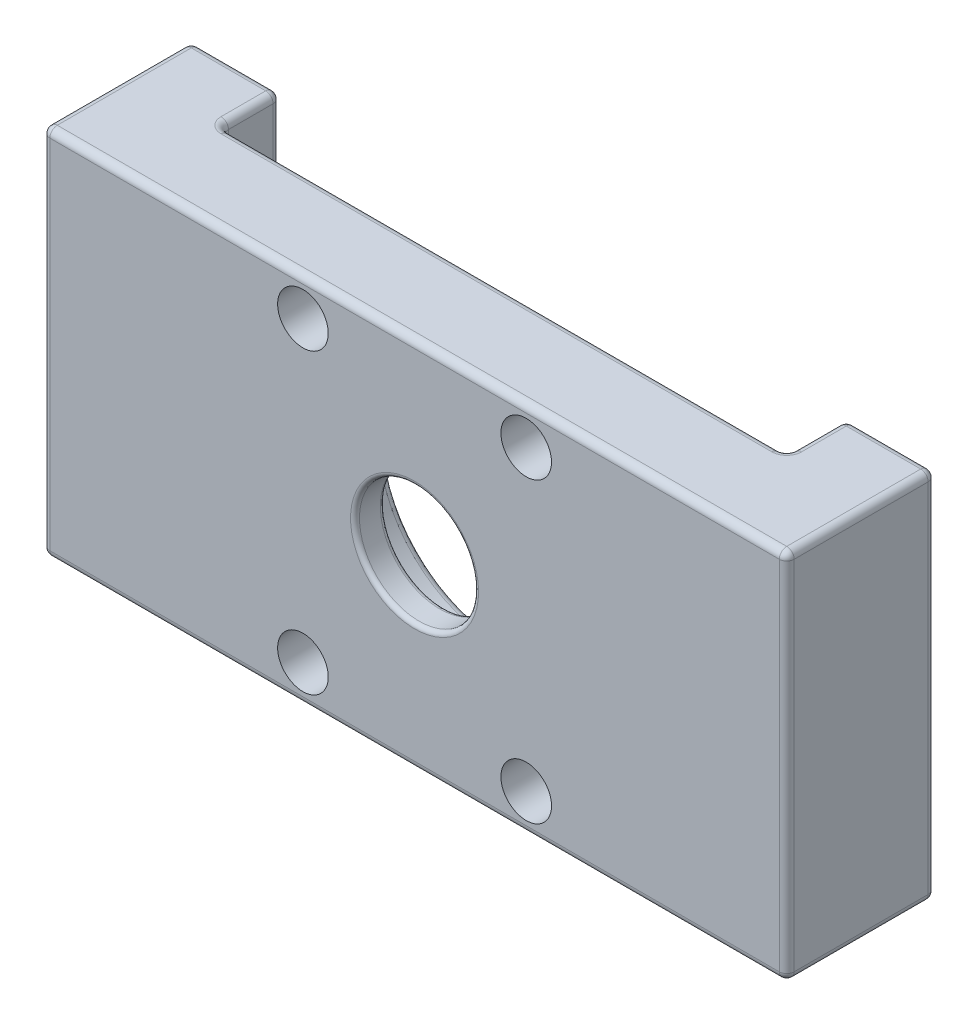
from build123d import *

# Parameters (mm, degrees)
SKETCH1_W               = 50
SKETCH1_H               = 25
SKETCH1_R               = 1.7
BOSS_EXTRUDE1_DEPTH     = 6
SKETCH2_R               = 4
CUT_EXTRUDE1_DEPTH      = 4
CUT_EXTRUDE2_DEPTH      = 2
CUT_EXTRUDE2_DEPTH_BACK = 45.337033054
SKETCH3_R               = 7.9
SKETCH5_W               = 6
SKETCH5_H               = 25
BOSS_EXTRUDE3_DEPTH     = 4
FILLET1_R               = 0.5
FILLET2_R               = 0.5
FILLET3_R               = 0.3


with BuildPart() as part:
    # Sketch1 → Boss-Extrude1 (new body)
    with BuildSketch(Plane.XY):
        with Locations((17.35, 0)):
            Rectangle(SKETCH1_W, SKETCH1_H)
        with Locations((9.85, 10)):
            Circle(SKETCH1_R, mode=Mode.SUBTRACT)
        with Locations(Location((24.85, 10, 0), (0, 0, 180))):
            Circle(SKETCH1_R, mode=Mode.SUBTRACT)
        with Locations((24.85, -10)):
            Circle(SKETCH1_R, mode=Mode.SUBTRACT)
        with Locations(Location((9.85, -10, 0), (0, 0, 180))):
            Circle(SKETCH1_R, mode=Mode.SUBTRACT)
    extrude(amount=BOSS_EXTRUDE1_DEPTH)

    # Sketch2 → Cut-Extrude1 (cut)
    with BuildSketch(Plane.XY.offset(6)):
        with Locations((17.35, 0)):
            Circle(SKETCH2_R)
    extrude(amount=-CUT_EXTRUDE1_DEPTH, mode=Mode.SUBTRACT)

    # Sketch3 → Cut-Extrude2 (cut, two sides: drawn at the far end of the back side and taken through both)
    with BuildSketch(Plane.XY.offset(2).offset(-CUT_EXTRUDE2_DEPTH_BACK)):
        with Locations((17.35, 0)):
            Circle(SKETCH3_R)
    extrude(amount=CUT_EXTRUDE2_DEPTH + CUT_EXTRUDE2_DEPTH_BACK, mode=Mode.SUBTRACT)

    # Sketch5 → Boss-Extrude3 (add)
    with BuildSketch(Plane(origin=(0, 0, 0), x_dir=(-1, 0, 0), z_dir=(0, 0, -1))):
        with Locations((4.65, 0)):
            Rectangle(SKETCH5_W, SKETCH5_H)
        with Locations((-39.35, 0)):
            Rectangle(SKETCH5_W, SKETCH5_H)
    extrude(amount=BOSS_EXTRUDE3_DEPTH)

    # Fillet1
    # the kernel refuses this fillet: 0.5 mm, written as the material it adds along each edge
    with BuildSketch(Plane(origin=(-1.65, 12.5, 0), x_dir=(0, 0, -1), z_dir=(0, -1, 0)), Plane(origin=(36.35, 12.5, 0), x_dir=(-1, 0, 0), z_dir=(0, -1, 0))) as fillet1_piece_1:
        with BuildLine():
            CenterArc((FILLET1_R, FILLET1_R), FILLET1_R, 180, 90)
            Line((0, FILLET1_R), (0, 0))
            Line((0, 0), (FILLET1_R, 0))
        make_face()
    extrude(amount=25)
    # the kernel refuses this fillet: 0.5 mm, written as the material it takes off along each edge
    with BuildSketch(Plane(origin=(-7.15, -12, 5.5), x_dir=(0, 0, 1), z_dir=(-1, 0, 0))) as fillet1_2_piece_1_section:
        Polygon((0, 0), (FILLET1_R, 0), (FILLET1_R, -FILLET1_R), (0, -FILLET1_R), align=None)
    fillet1_2_piece_1 = extrude(amount=FILLET1_R, mode=Mode.PRIVATE)
    fillet1_2_piece_1 = fillet1_2_piece_1 - Plane(origin=(-7.15, -12, 5.5), x_dir=(0, 0.7071067811865475, -0.7071067811865475), z_dir=(-1, 0, 0)) * Sphere(FILLET1_R, mode=Mode.PRIVATE)
    add(fillet1_2_piece_1, mode=Mode.SUBTRACT)
    with BuildSketch(Plane(origin=(41.85, -12, 5.5), x_dir=(0, -1, 0), z_dir=(0, 0, 1))) as fillet1_2_piece_2_section:
        Polygon((0, 0), (FILLET1_R, 0), (FILLET1_R, FILLET1_R), (0, FILLET1_R), align=None)
    fillet1_2_piece_2 = extrude(amount=FILLET1_R, mode=Mode.PRIVATE)
    fillet1_2_piece_2 = fillet1_2_piece_2 - Plane(origin=(41.85, -12, 5.5), x_dir=(-0.7071067811865475, 0.7071067811865475, 0), z_dir=(0, 0, 1)) * Sphere(FILLET1_R, mode=Mode.PRIVATE)
    add(fillet1_2_piece_2, mode=Mode.SUBTRACT)
    with BuildSketch(Plane(origin=(41.85, 12, 5.5), x_dir=(0, 0, 1), z_dir=(0, 1, 0))) as fillet1_2_piece_3_section:
        Polygon((0, 0), (FILLET1_R, 0), (FILLET1_R, FILLET1_R), (0, FILLET1_R), align=None)
    fillet1_2_piece_3 = extrude(amount=FILLET1_R, mode=Mode.PRIVATE)
    fillet1_2_piece_3 = fillet1_2_piece_3 - Plane(origin=(41.85, 12, 5.5), x_dir=(-0.7071067811865475, 0, -0.7071067811865475), z_dir=(0, 1, 0)) * Sphere(FILLET1_R, mode=Mode.PRIVATE)
    add(fillet1_2_piece_3, mode=Mode.SUBTRACT)
    with BuildSketch(Plane(origin=(-7.15, -12, -3.5), x_dir=(0, -1, 0), z_dir=(-1, 0, 0))) as fillet1_2_piece_4_section:
        Polygon((0, 0), (FILLET1_R, 0), (FILLET1_R, -FILLET1_R), (0, -FILLET1_R), align=None)
    fillet1_2_piece_4 = extrude(amount=FILLET1_R, mode=Mode.PRIVATE)
    fillet1_2_piece_4 = fillet1_2_piece_4 - Plane(origin=(-7.15, -12, -3.5), x_dir=(0, 0.7071067811865475, 0.7071067811865475), z_dir=(-1, 0, 0)) * Sphere(FILLET1_R, mode=Mode.PRIVATE)
    add(fillet1_2_piece_4, mode=Mode.SUBTRACT)
    with BuildSketch(Plane(origin=(-7.15, 12, -3.5), x_dir=(0, 1, 0), z_dir=(-1, 0, 0))) as fillet1_2_piece_5_section:
        Polygon((0, 0), (FILLET1_R, 0), (FILLET1_R, FILLET1_R), (0, FILLET1_R), align=None)
    fillet1_2_piece_5 = extrude(amount=FILLET1_R, mode=Mode.PRIVATE)
    fillet1_2_piece_5 = fillet1_2_piece_5 - Plane(origin=(-7.15, 12, -3.5), x_dir=(0, -0.7071067811865475, 0.7071067811865475), z_dir=(-1, 0, 0)) * Sphere(FILLET1_R, mode=Mode.PRIVATE)
    add(fillet1_2_piece_5, mode=Mode.SUBTRACT)
    with BuildSketch(Plane(origin=(-7.15, 12, 5.5), x_dir=(0, 1, 0), z_dir=(-1, 0, 0))) as fillet1_2_piece_6_section:
        Polygon((0, 0), (FILLET1_R, 0), (FILLET1_R, -FILLET1_R), (0, -FILLET1_R), align=None)
    fillet1_2_piece_6 = extrude(amount=FILLET1_R, mode=Mode.PRIVATE)
    fillet1_2_piece_6 = fillet1_2_piece_6 - Plane(origin=(-7.15, 12, 5.5), x_dir=(0, -0.7071067811865475, -0.7071067811865475), z_dir=(-1, 0, 0)) * Sphere(FILLET1_R, mode=Mode.PRIVATE)
    add(fillet1_2_piece_6, mode=Mode.SUBTRACT)
    with BuildSketch(Plane(origin=(41.85, 12, -3.5), x_dir=(1, 0, 0), z_dir=(0, 1, 0))) as fillet1_2_piece_7_section:
        Polygon((0, 0), (FILLET1_R, 0), (FILLET1_R, FILLET1_R), (0, FILLET1_R), align=None)
    fillet1_2_piece_7 = extrude(amount=FILLET1_R, mode=Mode.PRIVATE)
    fillet1_2_piece_7 = fillet1_2_piece_7 - Plane(origin=(41.85, 12, -3.5), x_dir=(-0.7071067811865475, 0, 0.7071067811865475), z_dir=(0, 1, 0)) * Sphere(FILLET1_R, mode=Mode.PRIVATE)
    add(fillet1_2_piece_7, mode=Mode.SUBTRACT)
    with BuildSketch(Plane(origin=(41.85, -12, -3.5), x_dir=(0, -1, 0), z_dir=(0, 0, -1))) as fillet1_2_piece_8_section:
        Polygon((0, 0), (FILLET1_R, 0), (FILLET1_R, -FILLET1_R), (0, -FILLET1_R), align=None)
    fillet1_2_piece_8 = extrude(amount=FILLET1_R, mode=Mode.PRIVATE)
    fillet1_2_piece_8 = fillet1_2_piece_8 - Plane(origin=(41.85, -12, -3.5), x_dir=(-0.7071067811865475, 0.7071067811865475, 0), z_dir=(0, 0, -1)) * Sphere(FILLET1_R, mode=Mode.PRIVATE)
    add(fillet1_2_piece_8, mode=Mode.SUBTRACT)
    with BuildSketch(Plane(origin=(9.85, 10, 0), x_dir=(1, 0, 0), z_dir=(0, -1, 0))) as fillet1_2_piece_9:
        with BuildLine():
            CenterArc((1.7 + FILLET1_R, FILLET1_R), FILLET1_R, 180, 90)
            Line((1.7, FILLET1_R), (1.7, 0))
            Line((1.7, 0), (1.7 + FILLET1_R, 0))
        make_face()
    revolve(axis=Axis((9.85, 10, 0), (0, 0, 1)), mode=Mode.SUBTRACT)
    with BuildSketch(Plane(origin=(-7.15, -12.5, 6), x_dir=(0, 1, 0), z_dir=(1, 0, 0))) as fillet1_2_piece_10:
        with BuildLine():
            CenterArc((FILLET1_R, -FILLET1_R), FILLET1_R, 90, 90)
            Line((0, -FILLET1_R), (0, 0))
            Line((0, 0), (FILLET1_R, 0))
        make_face()
    extrude(amount=49, mode=Mode.SUBTRACT)
    with BuildSketch(Plane(origin=(24.85, 10, 0), x_dir=(-1, 0, 0), z_dir=(0, 1, 0))) as fillet1_2_piece_11:
        with BuildLine():
            CenterArc((1.7 + FILLET1_R, FILLET1_R), FILLET1_R, 180, 90)
            Line((1.7, FILLET1_R), (1.7, 0))
            Line((1.7, 0), (1.7 + FILLET1_R, 0))
        make_face()
    revolve(axis=Axis((24.85, 10, 0), (0, 0, 1)), mode=Mode.SUBTRACT)
    with BuildSketch(Plane(origin=(42.35, -12, 6), x_dir=(-1, 0, 0), z_dir=(0, 1, 0)), Plane(origin=(42.35, -12, -4), x_dir=(0, 0, 1), z_dir=(0, 1, 0))) as fillet1_2_piece_12:
        with BuildLine():
            CenterArc((FILLET1_R, -FILLET1_R), FILLET1_R, 90, 90)
            Line((0, -FILLET1_R), (0, 0))
            Line((0, 0), (FILLET1_R, 0))
        make_face()
    extrude(amount=24, mode=Mode.SUBTRACT)
    with BuildSketch(Plane(origin=(-7.65, -12, -4), x_dir=(0, 0, 1), z_dir=(0, 1, 0)), Plane(origin=(-7.65, 12, 6), x_dir=(0, 0, -1), z_dir=(0, -1, 0))) as fillet1_2_piece_13:
        with BuildLine():
            CenterArc((FILLET1_R, FILLET1_R), FILLET1_R, 180, 90)
            Line((0, FILLET1_R), (0, 0))
            Line((0, 0), (FILLET1_R, 0))
        make_face()
    extrude(amount=24, mode=Mode.SUBTRACT)
    with BuildSketch(Plane(origin=(-7.15, 12.5, -4), x_dir=(0, 0, 1), z_dir=(1, 0, 0)), Plane(origin=(-0.4, -12.5, -4), x_dir=(0, 0, 1), z_dir=(-1, 0, 0))) as fillet1_2_piece_14:
        with BuildLine():
            CenterArc((FILLET1_R, FILLET1_R), FILLET1_R, 180, 90)
            Line((0, FILLET1_R), (0, 0))
            Line((0, 0), (FILLET1_R, 0))
        make_face()
    extrude(amount=6.75, mode=Mode.SUBTRACT)
    with BuildSketch(Plane(origin=(-1.65, 13.75, -4), x_dir=(-1, 0, 0), z_dir=(0, -1, 0)), Plane(origin=(36.35, 13.75, -4), x_dir=(0, 0, 1), z_dir=(0, -1, 0))) as fillet1_2_piece_15:
        with BuildLine():
            CenterArc((FILLET1_R, -FILLET1_R), FILLET1_R, 90, 90)
            Line((0, -FILLET1_R), (0, 0))
            Line((0, 0), (FILLET1_R, 0))
        make_face()
    extrude(amount=27.5, mode=Mode.SUBTRACT)
    with BuildSketch(Plane(origin=(41.85, 12.5, 6), x_dir=(0, 0, -1), z_dir=(-1, 0, 0))) as fillet1_2_piece_16:
        with BuildLine():
            CenterArc((FILLET1_R, FILLET1_R), FILLET1_R, 180, 90)
            Line((0, FILLET1_R), (0, 0))
            Line((0, 0), (FILLET1_R, 0))
        make_face()
    extrude(amount=49, mode=Mode.SUBTRACT)
    with BuildSketch(Plane(origin=(41.85, 12.5, -4), x_dir=(0, 0, 1), z_dir=(-1, 0, 0)), Plane(origin=(35.1, -12.5, -4), x_dir=(0, 0, 1), z_dir=(1, 0, 0))) as fillet1_2_piece_17:
        with BuildLine():
            CenterArc((FILLET1_R, -FILLET1_R), FILLET1_R, 90, 90)
            Line((0, -FILLET1_R), (0, 0))
            Line((0, 0), (FILLET1_R, 0))
        make_face()
    extrude(amount=6.75, mode=Mode.SUBTRACT)
    with BuildSketch(Plane(origin=(42.35, 12.5, 5.5), x_dir=(-1, 0, 0), z_dir=(0, 0, -1)), Plane(origin=(42.35, -12.5, -3.5), x_dir=(-1, 0, 0), z_dir=(0, 0, 1)), Plane(origin=(-7.65, -12.5, -3.5), x_dir=(0, 1, 0), z_dir=(0, 0, 1)), Plane(origin=(-7.65, 12.5, 5.5), x_dir=(0, -1, 0), z_dir=(0, 0, -1))) as fillet1_2_piece_18:
        with BuildLine():
            CenterArc((FILLET1_R, -FILLET1_R), FILLET1_R, 90, 90)
            Line((0, -FILLET1_R), (0, 0))
            Line((0, 0), (FILLET1_R, 0))
        make_face()
    extrude(amount=9, mode=Mode.SUBTRACT)
    # the kernel refuses this fillet: 0.5 mm, written as the material it takes off along each edge
    with BuildSketch(Plane(origin=(36.85, -12, -3.5), x_dir=(-1, 0, 0), z_dir=(0, -1, 0))) as fillet1_3_piece_1_section:
        Polygon((0, 0), (FILLET1_R, 0), (FILLET1_R, FILLET1_R), (0, FILLET1_R), align=None)
    fillet1_3_piece_1 = extrude(amount=FILLET1_R, mode=Mode.PRIVATE)
    fillet1_3_piece_1 = fillet1_3_piece_1 - Plane(origin=(36.85, -12, -3.5), x_dir=(0.7071067811865475, 0, 0.7071067811865475), z_dir=(0, -1, 0)) * Sphere(FILLET1_R, mode=Mode.PRIVATE)
    add(fillet1_3_piece_1, mode=Mode.SUBTRACT)
    with BuildSketch(Plane(origin=(36.85, 12, -3.5), x_dir=(-1, 0, 0), z_dir=(0, 1, 0))) as fillet1_3_piece_2_section:
        Polygon((0, 0), (FILLET1_R, 0), (FILLET1_R, -FILLET1_R), (0, -FILLET1_R), align=None)
    fillet1_3_piece_2 = extrude(amount=FILLET1_R, mode=Mode.PRIVATE)
    fillet1_3_piece_2 = fillet1_3_piece_2 - Plane(origin=(36.85, 12, -3.5), x_dir=(0.7071067811865475, 0, 0.7071067811865475), z_dir=(0, 1, 0)) * Sphere(FILLET1_R, mode=Mode.PRIVATE)
    add(fillet1_3_piece_2, mode=Mode.SUBTRACT)
    with BuildSketch(Plane(origin=(-2.15, -12, -3.5), x_dir=(1, 0, 0), z_dir=(0, -1, 0))) as fillet1_3_piece_3_section:
        Polygon((0, 0), (FILLET1_R, 0), (FILLET1_R, -FILLET1_R), (0, -FILLET1_R), align=None)
    fillet1_3_piece_3 = extrude(amount=FILLET1_R, mode=Mode.PRIVATE)
    fillet1_3_piece_3 = fillet1_3_piece_3 - Plane(origin=(-2.15, -12, -3.5), x_dir=(-0.7071067811865475, 0, 0.7071067811865475), z_dir=(0, -1, 0)) * Sphere(FILLET1_R, mode=Mode.PRIVATE)
    add(fillet1_3_piece_3, mode=Mode.SUBTRACT)
    with BuildSketch(Plane(origin=(-2.15, 12, -3.5), x_dir=(1, 0, 0), z_dir=(0, 1, 0))) as fillet1_3_piece_4_section:
        Polygon((0, 0), (FILLET1_R, 0), (FILLET1_R, FILLET1_R), (0, FILLET1_R), align=None)
    fillet1_3_piece_4 = extrude(amount=FILLET1_R, mode=Mode.PRIVATE)
    fillet1_3_piece_4 = fillet1_3_piece_4 - Plane(origin=(-2.15, 12, -3.5), x_dir=(-0.7071067811865475, 0, 0.7071067811865475), z_dir=(0, 1, 0)) * Sphere(FILLET1_R, mode=Mode.PRIVATE)
    add(fillet1_3_piece_4, mode=Mode.SUBTRACT)
    with BuildSketch(Plane(origin=(-1.15, -12.5, 0), x_dir=(0, 0, 1), z_dir=(1, 0, 0)), Plane(origin=(35.85, 12.5, 0), x_dir=(0, 0, 1), z_dir=(-1, 0, 0))) as fillet1_3_piece_5:
        with BuildLine():
            CenterArc((FILLET1_R, -FILLET1_R), FILLET1_R, 90, 90)
            Line((0, -FILLET1_R), (0, 0))
            Line((0, 0), (FILLET1_R, 0))
        make_face()
    extrude(amount=37, mode=Mode.SUBTRACT)
    with BuildSketch(Plane(origin=(-1.65, 12.5, -0.5), x_dir=(-1, 0, 0), z_dir=(0, 0, -1)), Plane(origin=(36.35, -12.5, -0.5), x_dir=(1, 0, 0), z_dir=(0, 0, -1))) as fillet1_3_piece_6:
        with BuildLine():
            CenterArc((FILLET1_R, -FILLET1_R), FILLET1_R, 90, 90)
            Line((0, -FILLET1_R), (0, 0))
            Line((0, 0), (FILLET1_R, 0))
        make_face()
    extrude(amount=3, mode=Mode.SUBTRACT)
    with BuildSketch(Plane(origin=(-1.65, -12.5, -0.5), x_dir=(-1, 0, 0), z_dir=(0, 0, -1)), Plane(origin=(36.35, 12.5, -0.5), x_dir=(1, 0, 0), z_dir=(0, 0, -1))) as fillet1_3_piece_7:
        with BuildLine():
            CenterArc((FILLET1_R, FILLET1_R), FILLET1_R, 180, 90)
            Line((0, FILLET1_R), (0, 0))
            Line((0, 0), (FILLET1_R, 0))
        make_face()
    extrude(amount=3, mode=Mode.SUBTRACT)
    with BuildSketch(Plane(origin=(35.85, -12.5, -0.5), x_dir=(0, 0, 1), z_dir=(-1, 0, 0))) as fillet1_3_piece_8:
        with BuildLine():
            CenterArc((0.5 + FILLET1_R, FILLET1_R), FILLET1_R, 180, 90)
            Line((0.5, FILLET1_R), (0.5, 0))
            Line((0.5, 0), (0.5 + FILLET1_R, 0))
        make_face()
    revolve(axis=Axis((35.85, -12.5, -0.5), (0, 1, 0)), revolution_arc=90, mode=Mode.SUBTRACT)
    with BuildSketch(Plane(origin=(35.85, 12.5, -0.5), x_dir=(0, 0, 1), z_dir=(-1, 0, 0))) as fillet1_3_piece_9:
        with BuildLine():
            CenterArc((0.5 + FILLET1_R, -FILLET1_R), FILLET1_R, 90, 90)
            Line((0.5, -FILLET1_R), (0.5, 0))
            Line((0.5, 0), (0.5 + FILLET1_R, 0))
        make_face()
    revolve(axis=Axis((35.85, 12.5, -0.5), (0, 1, 0)), revolution_arc=90, mode=Mode.SUBTRACT)
    with BuildSketch(Plane(origin=(-1.15, 12.5, -0.5), x_dir=(-1, 0, 0), z_dir=(0, 0, -1))) as fillet1_3_piece_10:
        with BuildLine():
            CenterArc((0.5 + FILLET1_R, -FILLET1_R), FILLET1_R, 90, 90)
            Line((0.5, -FILLET1_R), (0.5, 0))
            Line((0.5, 0), (0.5 + FILLET1_R, 0))
        make_face()
    revolve(axis=Axis((-1.15, 12.5, -0.5), (0, 1, 0)), revolution_arc=90, mode=Mode.SUBTRACT)
    with BuildSketch(Plane(origin=(-1.15, -12.5, -0.5), x_dir=(-1, 0, 0), z_dir=(0, 0, -1))) as fillet1_3_piece_11:
        with BuildLine():
            CenterArc((0.5 + FILLET1_R, FILLET1_R), FILLET1_R, 180, 90)
            Line((0.5, FILLET1_R), (0.5, 0))
            Line((0.5, 0), (0.5 + FILLET1_R, 0))
        make_face()
    revolve(axis=Axis((-1.15, -12.5, -0.5), (0, 1, 0)), revolution_arc=90, mode=Mode.SUBTRACT)

    # Fillet2
    fillet2_edges = [part.edges().sort_by_distance(p)[0] for p in [
        (9.45, 0, 0),
    ]]
    fillet(fillet2_edges, radius=FILLET2_R)

    # Fillet3
    fillet3_edges = [part.edges().sort_by_distance(p)[0] for p in [
        (13.35, 0, 6),
        (13.35, 0, 4),
    ]]
    fillet(fillet3_edges, radius=FILLET3_R)


solid = part.part
